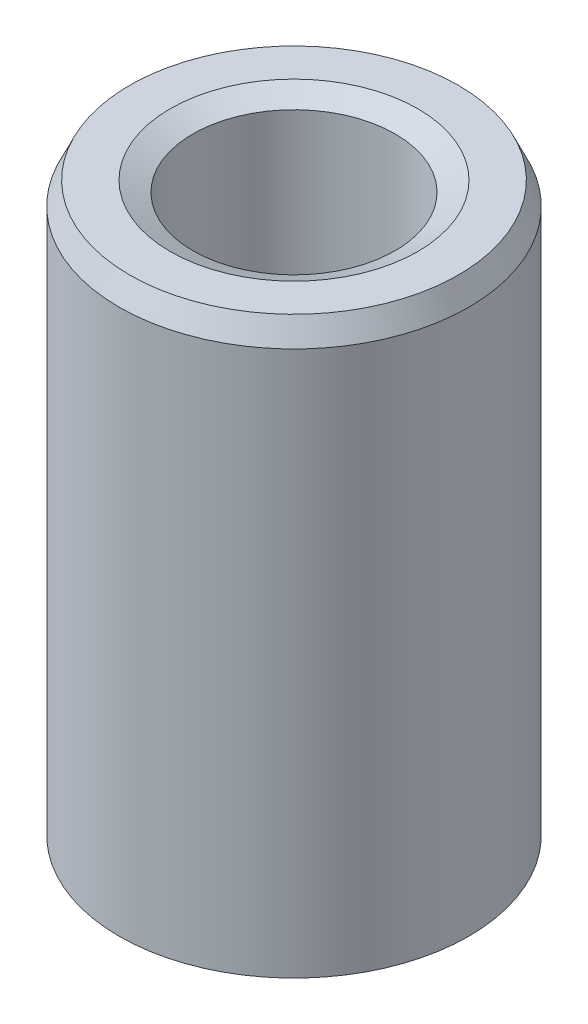
from build123d import *
from OCP.BRepFilletAPI import BRepFilletAPI_MakeChamfer

# Parameters (mm, degrees)
SKETCH1_R           = 7.5
BOSS_EXTRUDE1_DEPTH = 24.78991678
SKETCH2_R           = 4.339510191
CUT_EXTRUDE1_DEPTH  = 27.963678792
CHAMFER1_SIZE       = 0.96903468
CHAMFER1_SIZE2      = 0.451564398


with BuildPart() as part:
    # Sketch1 → Boss-Extrude1 (new body)
    with BuildSketch(Plane(origin=(0, 0, 0), x_dir=(1, 0, 0), z_dir=(0, 1, 0))):
        Circle(SKETCH1_R)
    extrude(amount=BOSS_EXTRUDE1_DEPTH)

    # Sketch2 → Cut-Extrude1 (cut, through all)
    with BuildSketch(Plane(origin=(0, 0, 0), x_dir=(1, 0, 0), z_dir=(0, 1, 0))):
        Circle(SKETCH2_R)
    extrude(amount=CUT_EXTRUDE1_DEPTH, mode=Mode.SUBTRACT)

    # Chamfer1: one chamfer whose edges measure the first distance from different faces: ONE call of the kernel's chamfer builder (chamfer() names one face for all edges)
    chamfer1_edges_1 = [part.edges().sort_by_distance(p)[0] for p in [
        (-4.339510191, 24.78991678, 0),
    ]]
    chamfer1_side_1 = [part.faces().sort_by_distance(p)[0] for p in [
        (-7.287867966, 24.78991678, 0),
    ]]
    chamfer1_edges_2 = [part.edges().sort_by_distance(p)[0] for p in [
        (-4.339510191, 0, 0),
    ]]
    chamfer1_side_2 = [part.faces().sort_by_distance(p)[0] for p in [
        (-4.339510191, 12.39495839, 0),
    ]]
    chamfer1_edges_3 = [part.edges().sort_by_distance(p)[0] for p in [
        (-7.5, 0, 0),
    ]]
    chamfer1_side_3 = [part.faces().sort_by_distance(p)[0] for p in [
        (-7.287867966, 0, 0),
    ]]
    chamfer1_edges_4 = [part.edges().sort_by_distance(p)[0] for p in [
        (-7.5, 24.78991678, 0),
    ]]
    chamfer1_side_4 = [part.faces().sort_by_distance(p)[0] for p in [
        (-7.5, 12.39495839, 0),
    ]]
    chamfer1 = BRepFilletAPI_MakeChamfer(part.part.solid().wrapped)
    for e in chamfer1_edges_1:
        chamfer1.Add(CHAMFER1_SIZE, CHAMFER1_SIZE2, e.wrapped, chamfer1_side_1[0].wrapped)  # the first distance lies on this face
    for e in chamfer1_edges_2:
        chamfer1.Add(CHAMFER1_SIZE, CHAMFER1_SIZE2, e.wrapped, chamfer1_side_2[0].wrapped)  # the first distance lies on this face
    for e in chamfer1_edges_3:
        chamfer1.Add(CHAMFER1_SIZE, CHAMFER1_SIZE2, e.wrapped, chamfer1_side_3[0].wrapped)  # the first distance lies on this face
    for e in chamfer1_edges_4:
        chamfer1.Add(CHAMFER1_SIZE, CHAMFER1_SIZE2, e.wrapped, chamfer1_side_4[0].wrapped)  # the first distance lies on this face
    add(Compound.cast(chamfer1.Shape()), mode=Mode.REPLACE)


solid = part.part
